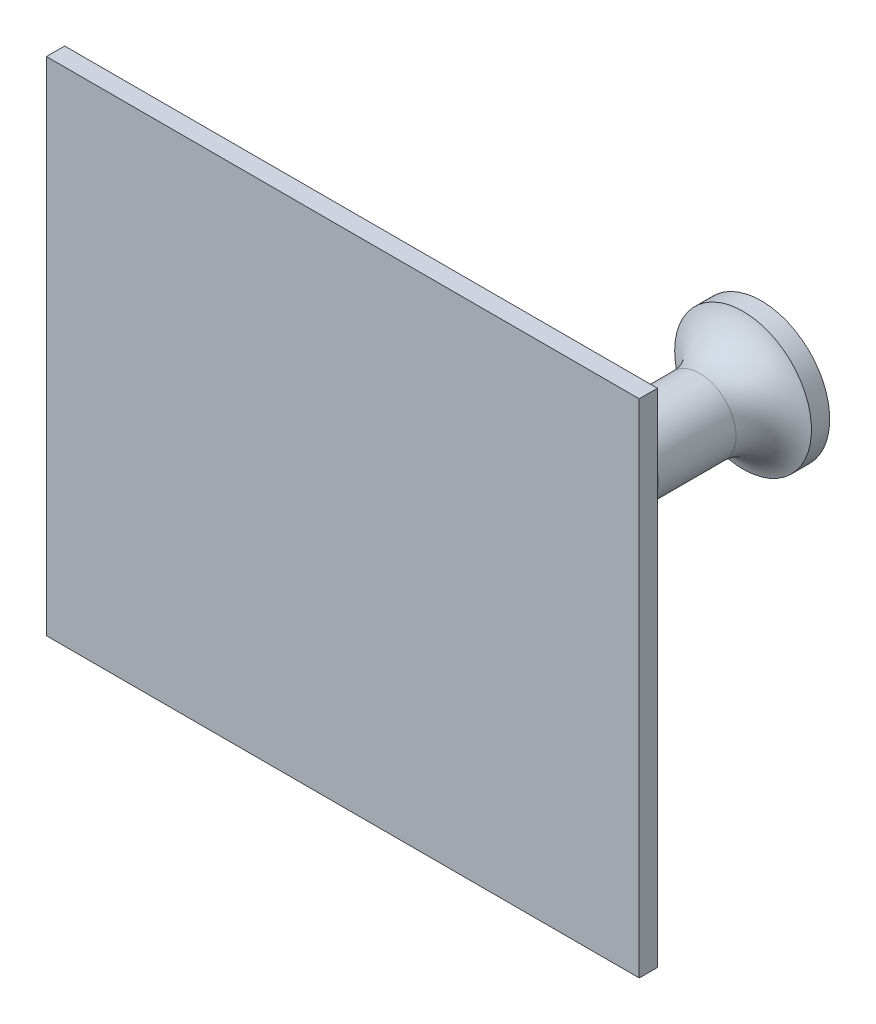
from build123d import *

# Parameters (mm, degrees)
SKIZZE2_W                       = 65
SKIZZE2_H                       = 100
AUFSATZ_LINEAR_AUSTRAGEN1_DEPTH = 2
SKIZZE3_R                       = 4
AUFSATZ_LINEAR_AUSTRAGEN2_DEPTH = 15
SKIZZE4_R                       = 5
AUFSATZ_LINEAR_AUSTRAGEN3_DEPTH = 2
SKIZZE5_R                       = 4
AUFSATZ_LINEAR_AUSTRAGEN4_DEPTH = 15
SKIZZE6_R                       = 7.5
AUFSATZ_LINEAR_AUSTRAGEN5_DEPTH = 2
VERRUNDUNG1_R                   = 2
VERRUNDUNG2_R                   = 2
VERRUNDUNG3_R                   = 5
SKIZZE7_W                       = 65
SKIZZE7_H                       = 45
SCHNITT_LINEAR_AUSTRAGEN1_DEPTH = 2
VERRUNDUNG4_R                   = 2


with BuildPart() as part:
    # Skizze2 → Aufsatz-Linear austragen1 (new body)
    with BuildSketch(Plane.XY):
        Rectangle(SKIZZE2_W, SKIZZE2_H)
    extrude(amount=AUFSATZ_LINEAR_AUSTRAGEN1_DEPTH)

    # Skizze3 → Aufsatz-Linear austragen2 (add)
    with BuildSketch(Plane(origin=(9.884440789, -5.646814133, 0), x_dir=(-1, 0, 0), z_dir=(0, 0, -1))):
        with Locations(Location((0, 28.149559508, 0), (0, 0, 180))):
            Circle(SKIZZE3_R)
    extrude(amount=AUFSATZ_LINEAR_AUSTRAGEN2_DEPTH)

    # Skizze4 → Aufsatz-Linear austragen3 (add)
    with BuildSketch(Plane(origin=(9.884440789, -5.646814133, -15), x_dir=(-1, 0, 0), z_dir=(0, 0, -1))):
        with Locations((0, 28.149559508)):
            Circle(SKIZZE4_R)
    extrude(amount=AUFSATZ_LINEAR_AUSTRAGEN3_DEPTH)

    # Skizze5 → Aufsatz-Linear austragen4 (add)
    with BuildSketch(Plane(origin=(9.884440789, -5.646814133, -17), x_dir=(-1, 0, 0), z_dir=(0, 0, -1))):
        with Locations(Location((0, 28.149559508, 0), (0, 0, 180))):
            Circle(SKIZZE5_R)
    extrude(amount=AUFSATZ_LINEAR_AUSTRAGEN4_DEPTH)

    # Skizze6 → Aufsatz-Linear austragen5 (add)
    with BuildSketch(Plane(origin=(9.884440789, -5.646814133, -32), x_dir=(-1, 0, 0), z_dir=(0, 0, -1))):
        with Locations((0, 28.149559508)):
            Circle(SKIZZE6_R)
    extrude(amount=AUFSATZ_LINEAR_AUSTRAGEN5_DEPTH)

    # Verrundung1
    # the kernel refuses this fillet: 2 mm, written as the material it adds along each edge
    with BuildSketch(Plane(origin=(9.884440789, 22.502745375, -15), x_dir=(1, 0, 0), z_dir=(0, 1, 0))) as verrundung1_piece_1:
        with BuildLine():
            CenterArc((6, -1.732050808), VERRUNDUNG1_R, 120, 60)
            Line((4, -1.732050808), (3.96, -1.732050808))
            Line((3.96, -1.732050808), (3.96, 0))
            Line((3.96, 0), (4, 0.04))
            ThreePointArc((4, 0.04), (4.5, 0.04), (4.98, 0.034641016))
            Line((4.98, 0.034641016), (5, 0))
        make_face()
    revolve(axis=Axis((9.884440789, 22.502745375, -15), (0, 0, -1)))

    # Verrundung2
    # the kernel refuses this fillet: 2 mm, written as the material it adds along each edge
    with BuildSketch(Plane(origin=(9.884440789, 22.502745375, -17), x_dir=(1, 0, 0), z_dir=(0, 1, 0))) as verrundung2_piece_1:
        with BuildLine():
            CenterArc((6, 1.732050808), VERRUNDUNG2_R, 180, 60)
            Line((4, 1.732050808), (3.96, 1.732050808))
            Line((3.96, 1.732050808), (3.96, 0))
            Line((3.96, 0), (4, -0.04))
            ThreePointArc((4, -0.04), (4.5, -0.04), (4.98, -0.034641016))
            Line((4.98, -0.034641016), (5, 0))
        make_face()
    revolve(axis=Axis((9.884440789, 22.502745375, -17), (0, 0, -1)))

    # Verrundung3
    # the kernel refuses this fillet: 5 mm, written as the material it adds along each edge
    with BuildSketch(Plane(origin=(9.884440789, 22.502745375, -32), x_dir=(1, 0, 0), z_dir=(0, 1, 0))) as verrundung3_piece_1:
        with BuildLine():
            CenterArc((9, -4.769696007), VERRUNDUNG3_R, 107.457603124, 72.542396876)
            Line((7.5, 0), (7.47, 0.09539392))
            ThreePointArc((7.47, 0.09539392), (5.75, 0.1), (4, 0.1))
            Line((4, 0.1), (3.9, 0))
            Line((3.9, 0), (3.9, -4.769696007))
            Line((3.9, -4.769696007), (4, -4.769696007))
        make_face()
    revolve(axis=Axis((9.884440789, 22.502745375, -32), (0, 0, -1)))

    # Skizze7 → Schnitt-Linear austragen1 (cut)
    with BuildSketch(Plane(origin=(0, 0, 0), x_dir=(-1, 0, 0), z_dir=(0, 0, -1))):
        with Locations((0, -27.5)):
            Rectangle(SKIZZE7_W, SKIZZE7_H)
    extrude(amount=-SCHNITT_LINEAR_AUSTRAGEN1_DEPTH, mode=Mode.SUBTRACT)

    # Verrundung4
    verrundung4_edges = [part.edges().sort_by_distance(p)[0] for p in [
        (5.884440789, 22.502745375, 0),
    ]]
    fillet(verrundung4_edges, radius=VERRUNDUNG4_R)


solid = part.part
